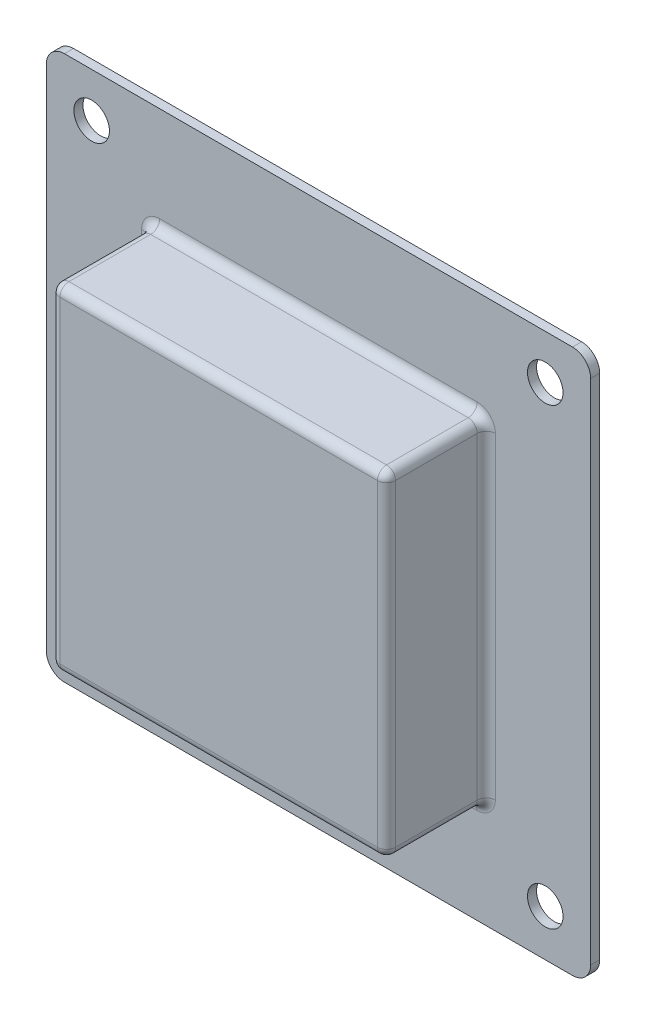
from build123d import *

# Parameters (mm, degrees)
BOSS_EXTRUDE1_DEPTH    = 1.27
SKETCH2_W              = 46.99
SKETCH2_H              = 46.99
SKETCH2_W_2            = 44.45
SKETCH2_H_2            = 44.45
BOSS_EXTRUDE2_DEPTH    = 12.7
SKETCH3_W              = 46.99
SKETCH3_H              = 46.99
BOSS_EXTRUDE3_DEPTH    = 1.27
CUT_EXTRUDE1_DEPTH     = 1.27
F_10_CLEARANCE_HOLE1_D = 4.9784
FILLET1_R              = 2.54
FILLET2_R              = 1.27
FILLET3_R              = 0.635


with BuildPart() as part:
    # Sketch1 → Boss-Extrude1 (new body)
    with BuildSketch(Plane.XY):
        Polygon((34.930491901, 50.295089045), (34.930491901, 88.395089045), (-41.269508099, 88.395089045), (-41.269508099, 12.195089045), (34.930491901, 12.195089045), align=None)
        Polygon((19.055491901, 50.295089045), (19.055491901, 72.520089045), (-25.394508099, 72.520089045), (-25.394508099, 28.070089045), (19.055491901, 28.070089045), align=None, mode=Mode.SUBTRACT)
    extrude(amount=BOSS_EXTRUDE1_DEPTH)

    # Sketch2 → Boss-Extrude2 (add)
    with BuildSketch(Plane.XY.offset(1.27)):
        with Locations((-3.169508099, 50.295089045)):
            Rectangle(SKETCH2_W, SKETCH2_H)
        with Locations((-3.169508099, 50.295089045)):
            Rectangle(SKETCH2_W_2, SKETCH2_H_2, mode=Mode.SUBTRACT)
    extrude(amount=BOSS_EXTRUDE2_DEPTH)

    # Sketch3 → Boss-Extrude3 (add)
    with BuildSketch(Plane.XY.offset(13.97)):
        with Locations((-3.169508099, 50.295089045)):
            Rectangle(SKETCH3_W, SKETCH3_H)
    extrude(amount=BOSS_EXTRUDE3_DEPTH)

    # Sketch4 → Cut-Extrude1 (cut)
    with BuildSketch(Plane.XZ.offset(-26.800089045)):
        with BuildLine():
            Line((-3.169508099, 2.54), (6.799991901, 2.54))
            ThreePointArc((6.799991901, 2.54), (7.608214952, 2.874776949), (7.942991901, 3.683))
            Line((7.942991901, 3.683), (7.942991901, 3.937))
            ThreePointArc((7.942991901, 3.937), (7.608214952, 4.745223051), (6.799991901, 5.08))
            Line((6.799991901, 5.08), (-13.139008099, 5.08))
            ThreePointArc((-13.139008099, 5.08), (-13.94723115, 4.745223051), (-14.282008099, 3.937))
            Line((-14.282008099, 3.937), (-14.282008099, 3.683))
            ThreePointArc((-14.282008099, 3.683), (-13.94723115, 2.874776949), (-13.139008099, 2.54))
            Line((-13.139008099, 2.54), (-3.169508099, 2.54))
        make_face()
    extrude(amount=-CUT_EXTRUDE1_DEPTH, mode=Mode.SUBTRACT)

    # #10 Clearance Hole1 (through all)
    with Locations(Plane(origin=(0, 0, 0), x_dir=(-1, 0, 0), z_dir=(0, 0, -1))):
        with Locations((-28.580491901, 82.181775554), (34.919508099, 82.181775554), (34.919508099, 18.681775554), (-28.580491901, 18.681775554)):
            Hole(F_10_CLEARANCE_HOLE1_D / 2)

    # Fillet1
    fillet1_edges = [part.edges().sort_by_distance(p)[0] for p in [
        (34.930491901, 12.195089045, 0.635),
        (-41.269508099, 12.195089045, 0.635),
        (-41.269508099, 88.395089045, 0.635),
        (34.930491901, 88.395089045, 0.635),
    ]]
    fillet(fillet1_edges, radius=FILLET1_R)

    # Fillet2
    fillet2_edges = [part.edges().sort_by_distance(p)[0] for p in [
        (-3.169508099, 73.790089045, 1.27),
        (20.325491901, 73.790089045, 8.255),
        (-26.664508099, 50.295089045, 1.27),
        (-26.664508099, 73.790089045, 8.255),
        (-3.169508099, 26.800089045, 1.27),
        (-26.664508099, 26.800089045, 8.255),
        (20.325491901, 50.295089045, 1.27),
        (20.325491901, 26.800089045, 8.255),
        (20.325491901, 50.295089045, 15.24),
        (-3.169508099, 73.790089045, 15.24),
        (-26.664508099, 50.295089045, 15.24),
        (-3.169508099, 26.800089045, 15.24),
    ]]
    fillet(fillet2_edges, radius=FILLET2_R - 0.0001)  # a hair under: the kernel refuses the full size

    # Fillet3
    fillet3_edges = [part.edges().sort_by_distance(p)[0] for p in [
        (19.055491901, 28.070089045, 6.985),
        (19.055491901, 72.520089045, 6.985),
        (-25.394508099, 72.520089045, 6.985),
        (-25.394508099, 28.070089045, 6.985),
        (19.055491901, 50.295089045, 13.97),
        (-3.169508099, 72.520089045, 13.97),
        (-25.394508099, 50.295089045, 13.97),
        (-3.169508099, 28.070089045, 13.97),
    ]]
    fillet(fillet3_edges, radius=FILLET3_R)


solid = part.part
